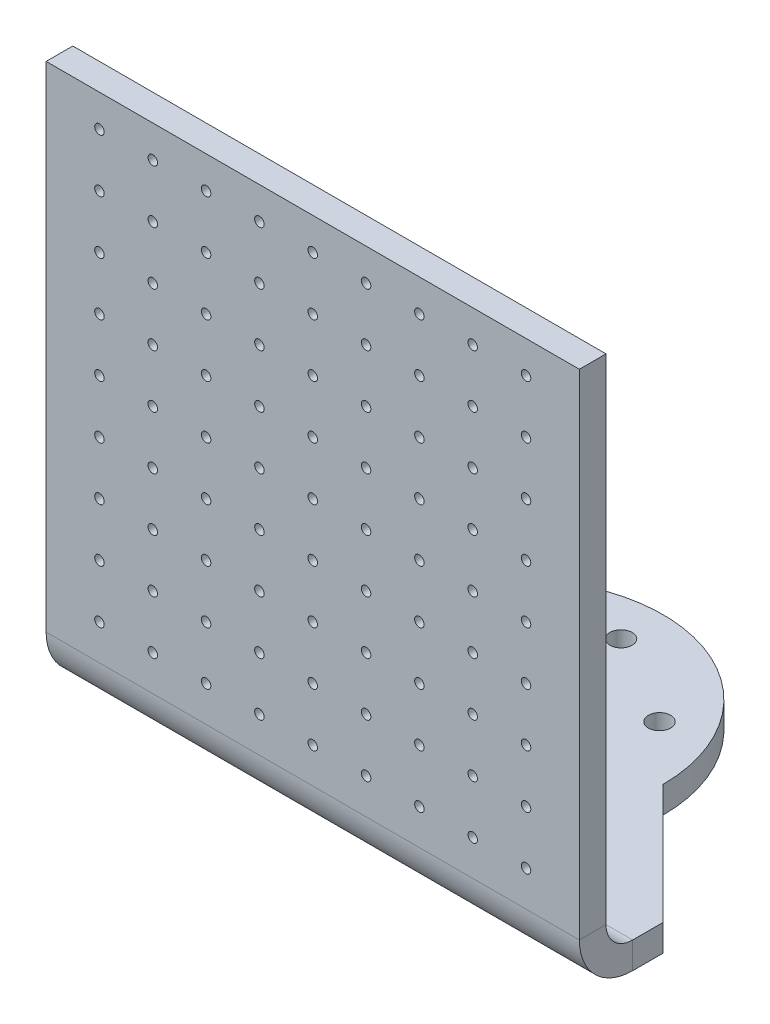
from build123d import *

# Parameters (mm, degrees)
SKETCH3_R                  = 2.65
BASE_FLANGE1_DEPTH         = 6.35
F_4_40_TAPPED_HOLE1_D      = 2.2606
LPATTERN1_COUNT            = 9
LPATTERN1_PITCH            = 12.7
LPATTERN1_COUNT_DIR2       = 9
LPATTERN1_PITCH_DIR2       = 12.7
SKETCHED_START             = 47.102289028
SKETCHED_BEND1_OUTLINE_W   = 127
SKETCHED_BEND1_OUTLINE_H   = 6.35
SKETCHED_BEND1_DEPTH       = 119.686790972
SKETCHED_START_2           = 35.707087028
SKETCHED_BEND1_2_OUTLINE_W = 127
SKETCHED_BEND1_2_OUTLINE_H = 124.066087028
SKETCHED_BEND1_2_OUTLINE_R = 1.1303
SKETCHED_BEND1_2_DEPTH     = 12.7
SKETCHED_START_3           = -63.5
SKETCHED_BEND1_3_DEPTH     = 127


with BuildPart() as part:
    # Base-Flange1: sheet metal written as solids
    # Sketch3 → Base-Flange1 (new body)
    with BuildSketch(Plane(origin=(0, 0, 0), x_dir=(1, 0, 0), z_dir=(0, 1, 0))):
        with BuildLine():
            Line((-63.5, -28.481), (-63.5, -166.78908))
            Line((-63.5, -166.78908), (63.5, -166.78908))
            Line((63.5, -166.78908), (63.5, -28.481))
            Line((63.5, -28.481), (35.019, 0))
            ThreePointArc((35.019, 0), (0, 35.019), (-35.019, 0))
            Line((-35.019, 0), (-63.5, -28.481))
        make_face()
        with Locations(Location((0, 25.019, 0), (0, 0, 270))):
            Circle(SKETCH3_R, mode=Mode.SUBTRACT)
        with Locations(Location((21.667089577, 12.5095, 0), (0, 0, 270))):
            Circle(SKETCH3_R, mode=Mode.SUBTRACT)
        with Locations(Location((21.667089577, -12.5095, 0), (0, 0, 270))):
            Circle(SKETCH3_R, mode=Mode.SUBTRACT)
        with Locations(Location((0, -25.019, 0), (0, 0, 270))):
            Circle(SKETCH3_R, mode=Mode.SUBTRACT)
        with Locations(Location((-21.667089577, -12.5095, 0), (0, 0, 270))):
            Circle(SKETCH3_R, mode=Mode.SUBTRACT)
        with Locations(Location((-21.667089577, 12.5095, 0), (0, 0, 270))):
            Circle(SKETCH3_R, mode=Mode.SUBTRACT)
    extrude(amount=-BASE_FLANGE1_DEPTH)

    # #4-40 Tapped Hole1 (through all)
    with Locations(Plane(origin=(-50.8, 0, 57.531), x_dir=(0, 0, 1), z_dir=(0, 1, 0))):
        with Locations((0, 0)):
            f_4_40_tapped_hole1 = Hole(F_4_40_TAPPED_HOLE1_D / 2)

    # LPattern1: 4-40 Tapped Hole1 9 × 9
    with Locations(*[(i * LPATTERN1_PITCH, 0, j * LPATTERN1_PITCH_DIR2) for i in range(LPATTERN1_COUNT) for j in range(LPATTERN1_COUNT_DIR2) if (i, j) != (0, 0)]):
        add(f_4_40_tapped_hole1, mode=Mode.SUBTRACT)

    # Sketched Bend1: read off the stored shape, not the designer's step
    # Sketched Bend1 outline → Sketched Bend1 (cut)
    with BuildSketch(Plane.XY.offset(SKETCHED_START)):
        with Locations((0, -3.175)):
            Rectangle(SKETCHED_BEND1_OUTLINE_W, SKETCHED_BEND1_OUTLINE_H)
    extrude(amount=SKETCHED_BEND1_DEPTH, mode=Mode.SUBTRACT)

    # Sketched Bend1 2 outline → Sketched Bend1 2 (add)
    with BuildSketch(Plane.XY.offset(SKETCHED_START_2)):
        with Locations((0, 62.033043514)):
            Rectangle(SKETCHED_BEND1_2_OUTLINE_W, SKETCHED_BEND1_2_OUTLINE_H)
        with Locations((-50.8, 14.808007028)):
            Circle(SKETCHED_BEND1_2_OUTLINE_R, mode=Mode.SUBTRACT)
        with Locations((-38.1, 14.808007028)):
            Circle(SKETCHED_BEND1_2_OUTLINE_R, mode=Mode.SUBTRACT)
        with Locations((-25.4, 14.808007028)):
            Circle(SKETCHED_BEND1_2_OUTLINE_R, mode=Mode.SUBTRACT)
        with Locations((-12.7, 14.808007028)):
            Circle(SKETCHED_BEND1_2_OUTLINE_R, mode=Mode.SUBTRACT)
        with Locations((-50.8, 27.508007028)):
            Circle(SKETCHED_BEND1_2_OUTLINE_R, mode=Mode.SUBTRACT)
        with Locations((-50.8, 40.208007028)):
            Circle(SKETCHED_BEND1_2_OUTLINE_R, mode=Mode.SUBTRACT)
        with Locations((-38.1, 27.508007028)):
            Circle(SKETCHED_BEND1_2_OUTLINE_R, mode=Mode.SUBTRACT)
        with Locations((-38.1, 40.208007028)):
            Circle(SKETCHED_BEND1_2_OUTLINE_R, mode=Mode.SUBTRACT)
        with Locations((-50.8, 52.908007028)):
            Circle(SKETCHED_BEND1_2_OUTLINE_R, mode=Mode.SUBTRACT)
        with Locations((-38.1, 52.908007028)):
            Circle(SKETCHED_BEND1_2_OUTLINE_R, mode=Mode.SUBTRACT)
        with Locations((-25.4, 27.508007028)):
            Circle(SKETCHED_BEND1_2_OUTLINE_R, mode=Mode.SUBTRACT)
        with Locations((-25.4, 40.208007028)):
            Circle(SKETCHED_BEND1_2_OUTLINE_R, mode=Mode.SUBTRACT)
        with Locations((-12.7, 27.508007028)):
            Circle(SKETCHED_BEND1_2_OUTLINE_R, mode=Mode.SUBTRACT)
        with Locations((-12.7, 40.208007028)):
            Circle(SKETCHED_BEND1_2_OUTLINE_R, mode=Mode.SUBTRACT)
        with Locations((-25.4, 52.908007028)):
            Circle(SKETCHED_BEND1_2_OUTLINE_R, mode=Mode.SUBTRACT)
        with Locations((-12.7, 52.908007028)):
            Circle(SKETCHED_BEND1_2_OUTLINE_R, mode=Mode.SUBTRACT)
        with Locations((0, 14.808007028)):
            Circle(SKETCHED_BEND1_2_OUTLINE_R, mode=Mode.SUBTRACT)
        with Locations((12.7, 14.808007028)):
            Circle(SKETCHED_BEND1_2_OUTLINE_R, mode=Mode.SUBTRACT)
        with Locations((25.4, 14.808007028)):
            Circle(SKETCHED_BEND1_2_OUTLINE_R, mode=Mode.SUBTRACT)
        with Locations((38.1, 14.808007028)):
            Circle(SKETCHED_BEND1_2_OUTLINE_R, mode=Mode.SUBTRACT)
        with Locations((50.8, 14.808007028)):
            Circle(SKETCHED_BEND1_2_OUTLINE_R, mode=Mode.SUBTRACT)
        with Locations((0, 27.508007028)):
            Circle(SKETCHED_BEND1_2_OUTLINE_R, mode=Mode.SUBTRACT)
        with Locations((12.7, 27.508007028)):
            Circle(SKETCHED_BEND1_2_OUTLINE_R, mode=Mode.SUBTRACT)
        with Locations((0, 40.208007028)):
            Circle(SKETCHED_BEND1_2_OUTLINE_R, mode=Mode.SUBTRACT)
        with Locations((12.7, 40.208007028)):
            Circle(SKETCHED_BEND1_2_OUTLINE_R, mode=Mode.SUBTRACT)
        with Locations((25.4, 27.508007028)):
            Circle(SKETCHED_BEND1_2_OUTLINE_R, mode=Mode.SUBTRACT)
        with Locations((25.4, 40.208007028)):
            Circle(SKETCHED_BEND1_2_OUTLINE_R, mode=Mode.SUBTRACT)
        with Locations((0, 52.908007028)):
            Circle(SKETCHED_BEND1_2_OUTLINE_R, mode=Mode.SUBTRACT)
        with Locations((12.7, 52.908007028)):
            Circle(SKETCHED_BEND1_2_OUTLINE_R, mode=Mode.SUBTRACT)
        with Locations((25.4, 52.908007028)):
            Circle(SKETCHED_BEND1_2_OUTLINE_R, mode=Mode.SUBTRACT)
        with Locations((38.1, 27.508007028)):
            Circle(SKETCHED_BEND1_2_OUTLINE_R, mode=Mode.SUBTRACT)
        with Locations((38.1, 40.208007028)):
            Circle(SKETCHED_BEND1_2_OUTLINE_R, mode=Mode.SUBTRACT)
        with Locations((50.8, 27.508007028)):
            Circle(SKETCHED_BEND1_2_OUTLINE_R, mode=Mode.SUBTRACT)
        with Locations((50.8, 40.208007028)):
            Circle(SKETCHED_BEND1_2_OUTLINE_R, mode=Mode.SUBTRACT)
        with Locations((38.1, 52.908007028)):
            Circle(SKETCHED_BEND1_2_OUTLINE_R, mode=Mode.SUBTRACT)
        with Locations((50.8, 52.908007028)):
            Circle(SKETCHED_BEND1_2_OUTLINE_R, mode=Mode.SUBTRACT)
        with Locations((-50.8, 65.608007028)):
            Circle(SKETCHED_BEND1_2_OUTLINE_R, mode=Mode.SUBTRACT)
        with Locations((-38.1, 65.608007028)):
            Circle(SKETCHED_BEND1_2_OUTLINE_R, mode=Mode.SUBTRACT)
        with Locations((-50.8, 78.308007028)):
            Circle(SKETCHED_BEND1_2_OUTLINE_R, mode=Mode.SUBTRACT)
        with Locations((-50.8, 91.008007028)):
            Circle(SKETCHED_BEND1_2_OUTLINE_R, mode=Mode.SUBTRACT)
        with Locations((-38.1, 78.308007028)):
            Circle(SKETCHED_BEND1_2_OUTLINE_R, mode=Mode.SUBTRACT)
        with Locations((-38.1, 91.008007028)):
            Circle(SKETCHED_BEND1_2_OUTLINE_R, mode=Mode.SUBTRACT)
        with Locations((-25.4, 65.608007028)):
            Circle(SKETCHED_BEND1_2_OUTLINE_R, mode=Mode.SUBTRACT)
        with Locations((-12.7, 65.608007028)):
            Circle(SKETCHED_BEND1_2_OUTLINE_R, mode=Mode.SUBTRACT)
        with Locations((-25.4, 78.308007028)):
            Circle(SKETCHED_BEND1_2_OUTLINE_R, mode=Mode.SUBTRACT)
        with Locations((-25.4, 91.008007028)):
            Circle(SKETCHED_BEND1_2_OUTLINE_R, mode=Mode.SUBTRACT)
        with Locations((-12.7, 78.308007028)):
            Circle(SKETCHED_BEND1_2_OUTLINE_R, mode=Mode.SUBTRACT)
        with Locations((-12.7, 91.008007028)):
            Circle(SKETCHED_BEND1_2_OUTLINE_R, mode=Mode.SUBTRACT)
        with Locations((-50.8, 103.708007028)):
            Circle(SKETCHED_BEND1_2_OUTLINE_R, mode=Mode.SUBTRACT)
        with Locations((-38.1, 103.708007028)):
            Circle(SKETCHED_BEND1_2_OUTLINE_R, mode=Mode.SUBTRACT)
        with Locations((-50.8, 116.408007028)):
            Circle(SKETCHED_BEND1_2_OUTLINE_R, mode=Mode.SUBTRACT)
        with Locations((-38.1, 116.408007028)):
            Circle(SKETCHED_BEND1_2_OUTLINE_R, mode=Mode.SUBTRACT)
        with Locations((-25.4, 103.708007028)):
            Circle(SKETCHED_BEND1_2_OUTLINE_R, mode=Mode.SUBTRACT)
        with Locations((-12.7, 103.708007028)):
            Circle(SKETCHED_BEND1_2_OUTLINE_R, mode=Mode.SUBTRACT)
        with Locations((-25.4, 116.408007028)):
            Circle(SKETCHED_BEND1_2_OUTLINE_R, mode=Mode.SUBTRACT)
        with Locations((-12.7, 116.408007028)):
            Circle(SKETCHED_BEND1_2_OUTLINE_R, mode=Mode.SUBTRACT)
        with Locations((0, 65.608007028)):
            Circle(SKETCHED_BEND1_2_OUTLINE_R, mode=Mode.SUBTRACT)
        with Locations((12.7, 65.608007028)):
            Circle(SKETCHED_BEND1_2_OUTLINE_R, mode=Mode.SUBTRACT)
        with Locations((25.4, 65.608007028)):
            Circle(SKETCHED_BEND1_2_OUTLINE_R, mode=Mode.SUBTRACT)
        with Locations((0, 78.308007028)):
            Circle(SKETCHED_BEND1_2_OUTLINE_R, mode=Mode.SUBTRACT)
        with Locations((12.7, 78.308007028)):
            Circle(SKETCHED_BEND1_2_OUTLINE_R, mode=Mode.SUBTRACT)
        with Locations((0, 91.008007028)):
            Circle(SKETCHED_BEND1_2_OUTLINE_R, mode=Mode.SUBTRACT)
        with Locations((12.7, 91.008007028)):
            Circle(SKETCHED_BEND1_2_OUTLINE_R, mode=Mode.SUBTRACT)
        with Locations((25.4, 78.308007028)):
            Circle(SKETCHED_BEND1_2_OUTLINE_R, mode=Mode.SUBTRACT)
        with Locations((25.4, 91.008007028)):
            Circle(SKETCHED_BEND1_2_OUTLINE_R, mode=Mode.SUBTRACT)
        with Locations((38.1, 65.608007028)):
            Circle(SKETCHED_BEND1_2_OUTLINE_R, mode=Mode.SUBTRACT)
        with Locations((50.8, 65.608007028)):
            Circle(SKETCHED_BEND1_2_OUTLINE_R, mode=Mode.SUBTRACT)
        with Locations((38.1, 78.308007028)):
            Circle(SKETCHED_BEND1_2_OUTLINE_R, mode=Mode.SUBTRACT)
        with Locations((38.1, 91.008007028)):
            Circle(SKETCHED_BEND1_2_OUTLINE_R, mode=Mode.SUBTRACT)
        with Locations((50.8, 78.308007028)):
            Circle(SKETCHED_BEND1_2_OUTLINE_R, mode=Mode.SUBTRACT)
        with Locations((50.8, 91.008007028)):
            Circle(SKETCHED_BEND1_2_OUTLINE_R, mode=Mode.SUBTRACT)
        with Locations((0, 103.708007028)):
            Circle(SKETCHED_BEND1_2_OUTLINE_R, mode=Mode.SUBTRACT)
        with Locations((12.7, 103.708007028)):
            Circle(SKETCHED_BEND1_2_OUTLINE_R, mode=Mode.SUBTRACT)
        with Locations((25.4, 103.708007028)):
            Circle(SKETCHED_BEND1_2_OUTLINE_R, mode=Mode.SUBTRACT)
        with Locations((0, 116.408007028)):
            Circle(SKETCHED_BEND1_2_OUTLINE_R, mode=Mode.SUBTRACT)
        with Locations((12.7, 116.408007028)):
            Circle(SKETCHED_BEND1_2_OUTLINE_R, mode=Mode.SUBTRACT)
        with Locations((25.4, 116.408007028)):
            Circle(SKETCHED_BEND1_2_OUTLINE_R, mode=Mode.SUBTRACT)
        with Locations((38.1, 103.708007028)):
            Circle(SKETCHED_BEND1_2_OUTLINE_R, mode=Mode.SUBTRACT)
        with Locations((50.8, 103.708007028)):
            Circle(SKETCHED_BEND1_2_OUTLINE_R, mode=Mode.SUBTRACT)
        with Locations((38.1, 116.408007028)):
            Circle(SKETCHED_BEND1_2_OUTLINE_R, mode=Mode.SUBTRACT)
        with Locations((50.8, 116.408007028)):
            Circle(SKETCHED_BEND1_2_OUTLINE_R, mode=Mode.SUBTRACT)
    extrude(amount=SKETCHED_BEND1_2_DEPTH)

    # Sketched Bend1 3 outline → Sketched Bend1 3 (cut)
    with BuildSketch(Plane.YZ.offset(SKETCHED_START_3)):
        with BuildLine():
            ThreePointArc((-6.35, 35.707087028), (-2.630256121, 44.687343149), (6.35, 48.407087028))
            Line((6.35, 48.407087028), (0, 48.407087028))
            Line((0, 48.407087028), (0, 47.102289028))
            Line((0, 47.102289028), (-6.35, 47.102289028))
            Line((-6.35, 47.102289028), (-6.35, 35.707087028))
        make_face()
        with BuildLine():
            Line((124.066087028, 42.057087028), (6.35, 42.057087028))
            ThreePointArc((6.35, 42.057087028), (1.859871939, 40.197215088), (0, 35.707087028))
            Line((0, 35.707087028), (124.066087028, 35.707087028))
            Line((124.066087028, 35.707087028), (124.066087028, 42.057087028))
        make_face()
    extrude(amount=SKETCHED_BEND1_3_DEPTH, mode=Mode.SUBTRACT)


solid = part.part
